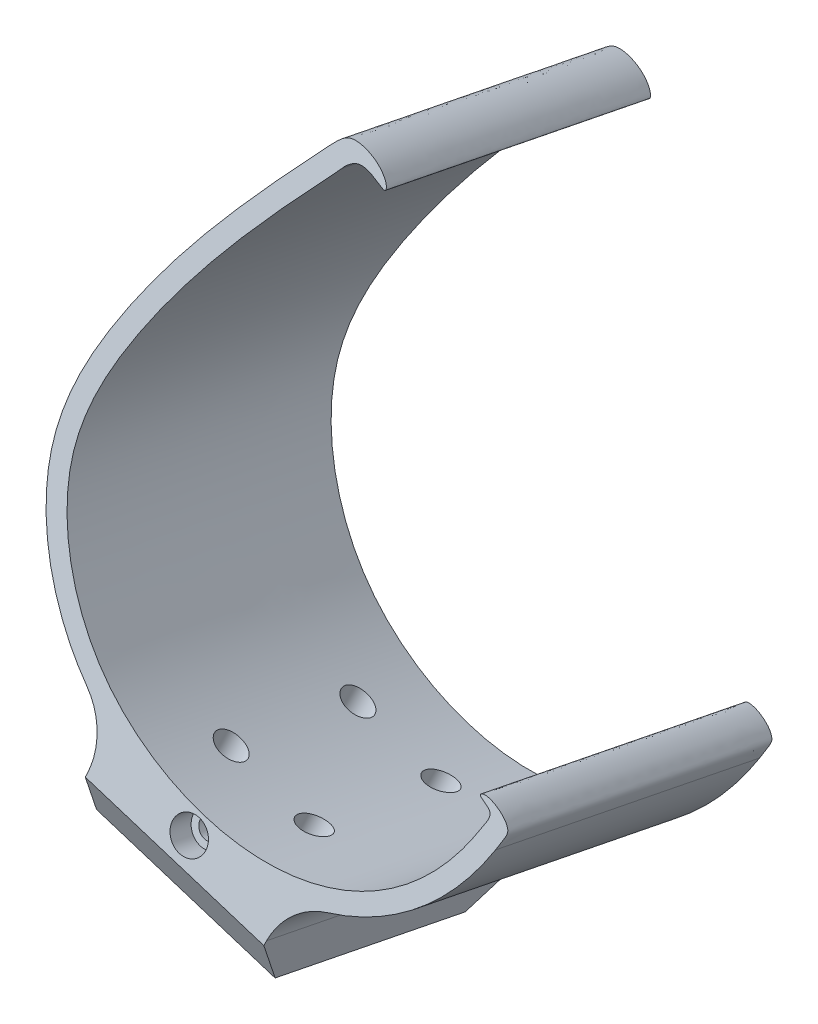
from build123d import *

# Parameters (mm, degrees)
EXTRUDE_1_DEPTH     = 50
SKETCH_9_R          = 1.65
CUT_EXTRUDE_1_DEPTH = 247.309398888
SKETCH_10_R         = 2.4
CUT_EXTRUDE_2_DEPTH = 6.5
FILLET_1_R          = 10
CHAMFER_1_SIZE      = 7
SKETCH_12_R         = 1.65
CUT_EXTRUDE_3_DEPTH = 324.390705607
SKETCH_13_R         = 2.4
CUT_EXTRUDE_4_DEPTH = 5.5
SKETCH_14_R         = 2.75
CUT_EXTRUDE_6_DEPTH = 4


with BuildPart() as part:
    # 草图4 → 凸台-拉伸1 (new body)
    with BuildSketch(Plane(origin=(-22.336321771, -58.75761937, -205.605522532), x_dir=(0.9941507488975471, 0, -0.10800133548455057), z_dir=(0.1038898687032814, 0.27329125288470996, 0.9563047559630353))):
        with BuildLine():
            Line((87.151915271, 181.222900276), (91.767149986, 194.440298224))
            add(Edge.make_bspline(
                [(91.767149986, 194.440298224), (92.176273648, 194.452712581), (92.993895614, 194.49182663), (95.106432908, 194.668981057), (98.418166676, 195.20462231), (102.83007337, 196.582836387), (107.329105988, 198.895088895), (110.788799881, 201.551866352), (113.329900482, 204.125962707), (115.110492144, 206.281155441), (116.482710011, 208.267941532), (117.505865872, 209.966395739), (117.997311466, 210.8624482), (118.232336453, 211.311701054)],
                knots=[0.803276943, 0.803276943, 0.803276943, 0.803276943, 0.811089443, 0.818901943, 0.84375, 0.875, 0.90625, 0.9375, 0.953125, 0.96875, 0.984375, 0.9921875, 1, 1, 1, 1], degree=3))
            add(Edge.make_bspline(
                [(118.232336453, 211.311701054), (118.552099138, 211.952833941), (119.53536246, 213.675950239), (119.425337042, 214.285834535), (118.384691416, 215.94009147), (115.538875293, 217.51002616), (114.391213338, 216.691462462), (116.506331361, 215.881031498), (116.636096296, 214.572981361), (116.394477433, 214.197257798), (115.574117605, 212.702338519)],
                knots=[0, 0, 0, 0, 0.094760542, 0.211303265, 0.266432641, 0.590924919, 0.653668515, 0.831125004, 0.867976358, 1, 1, 1, 1], degree=3))
            add(Edge.make_bspline(
                [(80.268529575, 281.816209793), (71.589644625, 272.323094632), (59.221904004, 258.506008126), (48.723798308, 233.817388337), (55.150071774, 216.124190839), (76.126369863, 195.390024638), (104.910613657, 192.318933135), (115.574117605, 212.702338519)],
                knots=[0, 0, 0, 0, 0.265722908, 0.387791022, 0.533535177, 0.620247321, 1, 1, 1, 1], degree=3))
            add(Edge.make_bspline(
                [(78.054381042, 283.840449471), (78.549347417, 284.278828653), (79.746519889, 285.967211311), (84.170954135, 285.465861193), (87.00381347, 282.659216922), (86.56917017, 281.014728239), (82.668387092, 284.54765042), (80.399335469, 282.043582845), (80.268529575, 281.816209793)],
                knots=[0, 0, 0, 0, 0.185673217, 0.241813161, 0.609548789, 0.679608524, 0.872350775, 1, 1, 1, 1], degree=3))
            add(Edge.make_bspline(
                [(78.054381042, 283.840449471), (76.007061149, 281.601055399), (71.927748333, 277.117435513), (65.979998338, 270.181956229), (60.375581348, 262.888716988), (56.139753608, 256.375806414), (53.08552943, 250.834673288), (50.331278392, 244.972066789), (48.396009479, 238.642438983), (48.155498931, 231.871869378), (49.095262846, 225.206442711), (52.096632336, 217.239592562), (56.875471356, 210.405924993), (60.923865156, 206.40179173), (62.806136897, 204.833080374), (63.444154383, 204.330086899)],
                knots=[0, 0, 0, 0, 0.0625, 0.125, 0.1875, 0.25, 0.28125, 0.3125, 0.375, 0.40625, 0.4375, 0.5, 0.5625, 0.594066974, 0.609691974, 0.609691974, 0.609691974, 0.609691974], degree=3))
            Line((63.444154383, 204.330086899), (58.828919668, 191.112688951))
            Line((58.828919668, 191.112688951), (87.151915271, 181.222900276))
        make_face()
    extrude(amount=EXTRUDE_1_DEPTH)

    # 草图8 → 切除-旋转1 (revolve, cut)
    with BuildSketch(Plane(origin=(60.219879411, 182.379244137, -58.662144202), x_dir=(-0.9539814958918524, 0.285463453712426, -0.09181460717400708), z_dir=(-0.2998654789722988, -0.9081592313509129, 0.292108721254318))):
        with BuildLine():
            Line((14.291455584, 199.681200474), (12.102624016, 179.700734604))
            ThreePointArc((12.102624016, 179.700734604), (3.206806865, 190.785383323), (14.291455584, 199.681200474))
        make_face()
    revolve(axis=Axis((45.032126728, 121.231174859, -264.361125282), (0.10388986870327992, 0.2732912528847103, 0.9563047559630353)), mode=Mode.SUBTRACT)

    # 草图9 → 切除-拉伸1 (cut, through all)
    with BuildSketch(Plane(origin=(59.920013932, 181.471084905, -58.370035481), x_dir=(-0.9539814959005866, 0.2854621437233053, -0.09181867990868915), z_dir=(-0.2998654789722874, -0.9081592313509168, 0.29210872125431797))):
        with Locations((18.849403129, 176.999970908)):
            Circle(SKETCH_9_R)
        with Locations((4.932667255, 178.524589748)):
            Circle(SKETCH_9_R)
        with Locations((21.463035427, 200.857232406)):
            Circle(SKETCH_9_R)
        with Locations((7.546299553, 202.381851247)):
            Circle(SKETCH_9_R)
    extrude(amount=-CUT_EXTRUDE_1_DEPTH, mode=Mode.SUBTRACT)

    # 草图10 → 切除-拉伸2 (cut)
    with BuildSketch(Plane(origin=(62.768735982, 190.098597603, -61.145068333), x_dir=(-0.9539814959005866, 0.2854621437233053, -0.09181867990868915), z_dir=(-0.2998654789722874, -0.9081592313509168, 0.29210872125431797))):
        with Locations((21.463035427, 200.857232406)):
            Circle(SKETCH_10_R)
        with Locations((7.546299553, 202.381851247)):
            Circle(SKETCH_10_R)
        with Locations((4.932667255, 178.524589748)):
            Circle(SKETCH_10_R)
        with Locations((18.849403129, 176.999970908)):
            Circle(SKETCH_10_R)
    extrude(amount=-CUT_EXTRUDE_2_DEPTH, mode=Mode.SUBTRACT)

    # 圆角1
    fillet_1_edges = [part.edges().sort_by_distance(p)[0] for p in [
        (37.303008415, 144.626174994, -244.064950796),
        (65.75224093, 135.112877383, -244.436888722),
    ]]
    fillet(fillet_1_edges, radius=FILLET_1_R)

    # 倒角1
    chamfer_1_edges = [part.edges().sort_by_distance(p)[0] for p in [
        (49.926754684, 133.987578272, -216.253778763),
        (44.732261249, 120.323015627, -264.069016561),
    ]]
    chamfer(chamfer_1_edges, length=CHAMFER_1_SIZE)

    # 草图12 → 切除-拉伸3 (cut, through all)
    with BuildSketch(Plane(origin=(-22.336321771, -58.75761937, -205.605522532), x_dir=(-0.9945888070860314, 0.028546663885281345, 0.09989090449187994), z_dir=(-0.10388986870328168, -0.2732912528847102, -0.9563047559630352))):
        with Locations((-70.74994489, 198.74003038)):
            Circle(SKETCH_12_R)
    extrude(amount=-CUT_EXTRUDE_3_DEPTH, mode=Mode.SUBTRACT)

    # 草图13 → 切除-拉伸4 (cut)
    with BuildSketch(Plane(origin=(-22.336321771, -58.75761937, -205.605522532), x_dir=(-0.9945888070860314, 0.028546663885281334, 0.0998909044918799), z_dir=(-0.10388986870328165, -0.2732912528847101, -0.9563047559630353))):
        with Locations((-70.74994489, 198.74003038)):
            Circle(SKETCH_13_R)
    extrude(amount=-CUT_EXTRUDE_4_DEPTH, mode=Mode.SUBTRACT)

    # 草图14 → 切除-拉伸6 (cut)
    with BuildSketch(Plane(origin=(-17.141828336, -45.093056726, -157.790284734), x_dir=(0.9945888070860314, -0.028546663885281334, -0.0998909044918799), z_dir=(0.10388986870328164, 0.2732912528847101, 0.9563047559630352))):
        with Locations((70.74994489, 198.74003038)):
            Circle(SKETCH_14_R)
    extrude(amount=-CUT_EXTRUDE_6_DEPTH, mode=Mode.SUBTRACT)


solid = part.part
